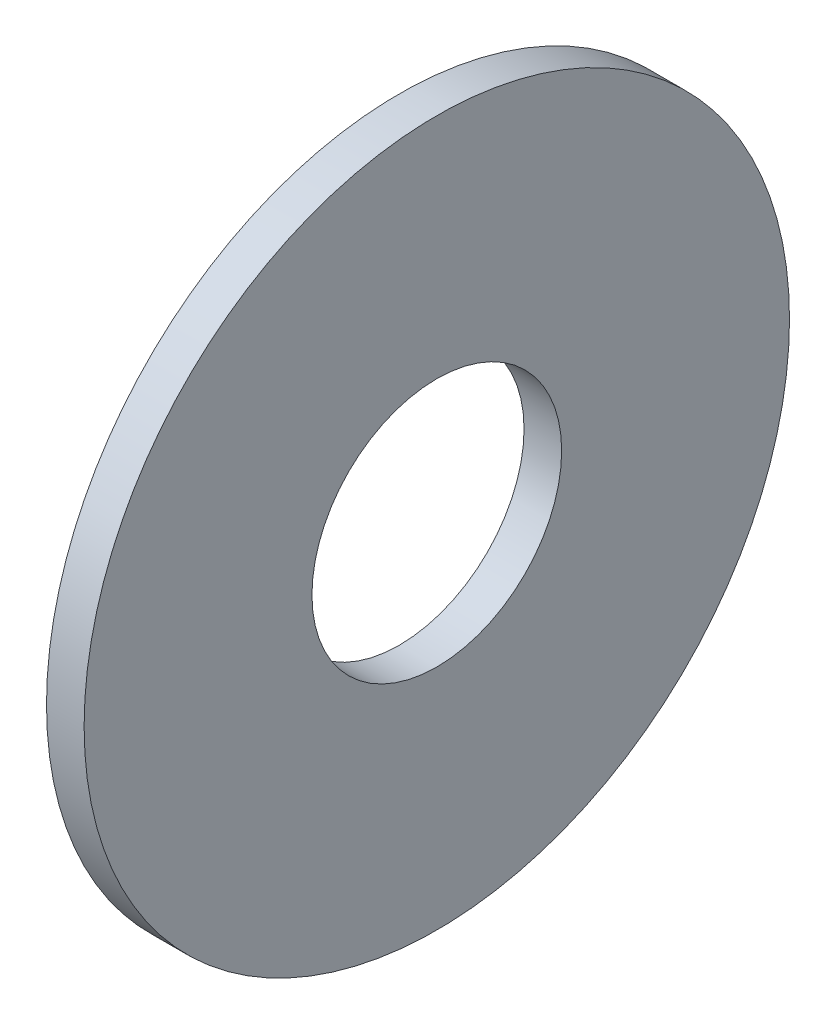
from build123d import *

# Parameters (mm, degrees)
SKETCH1_W = 4.064
SKETCH1_H = 24.6126


with BuildPart() as part:
    # Sketch1 → Base-Revolve (revolve)
    with BuildSketch(Plane.XY):
        with Locations((-2.032, 25.7937)):
            Rectangle(SKETCH1_W, SKETCH1_H)
    revolve(axis=Axis((-34.925, 0, 0), (1, 0, 0)))


solid = part.part
